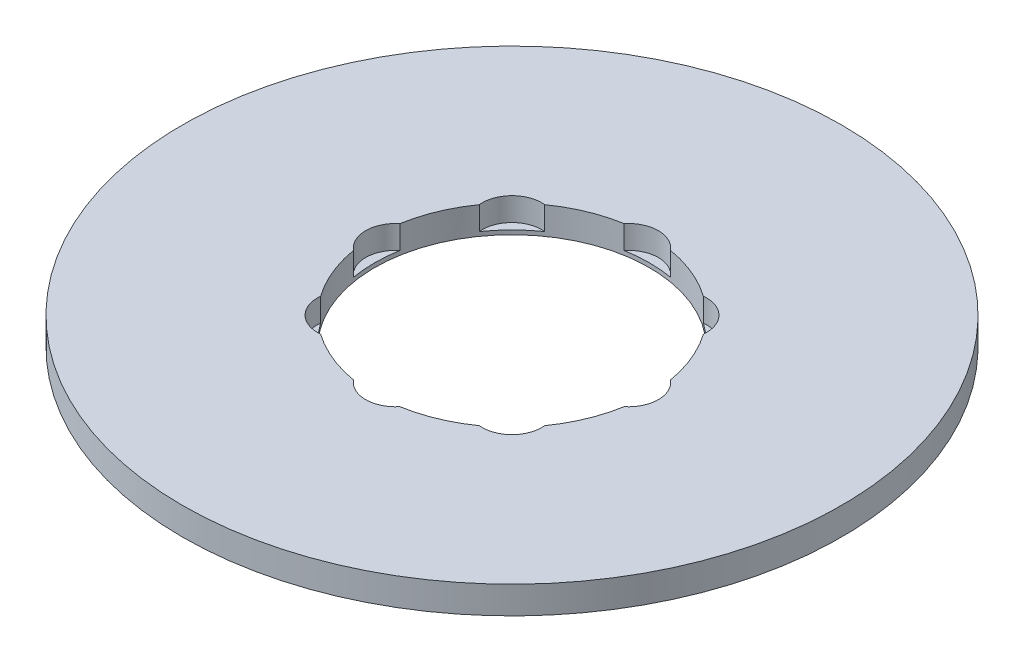
from build123d import *

# Parameters (mm, degrees)
SKETCH1_R           = 60
BOSS_EXTRUDE1_DEPTH = 5
SKETCH2_R           = 25
CUT_EXTRUDE1_DEPTH  = 86
SKETCH3_R           = 5.43317354
CUT_EXTRUDE2_DEPTH  = 4.237939286
CIRPATTERN1_COUNT   = 8


with BuildPart() as part:
    # Sketch1 → Boss-Extrude1 (new body)
    with BuildSketch(Plane(origin=(0, 0, 0), x_dir=(1, 0, 0), z_dir=(0, 1, 0))):
        Circle(SKETCH1_R)
    extrude(amount=BOSS_EXTRUDE1_DEPTH)

    # Sketch2 → Cut-Extrude1 (cut, through all)
    with BuildSketch(Plane(origin=(0, 0, 0), x_dir=(1, 0, 0), z_dir=(0, 1, 0))):
        Circle(SKETCH2_R)
    extrude(amount=CUT_EXTRUDE1_DEPTH, mode=Mode.SUBTRACT)

    # Sketch3 → Cut-Extrude2 (cut)
    with BuildSketch(Plane(origin=(0, 5, 0), x_dir=(1, 0, 0), z_dir=(0, 1, 0))):
        with Locations((-21.212737804, 0)):
            Circle(SKETCH3_R)
    cut_extrude2 = extrude(amount=-CUT_EXTRUDE2_DEPTH, mode=Mode.SUBTRACT)

    # CirPattern1: Cut-Extrude2 ×8 about axis
    cirpattern1_axis = Axis((0, 0, 0), (0, 1, 0))
    for i in range(1, CIRPATTERN1_COUNT):
        add(cut_extrude2.rotate(cirpattern1_axis, i * 360 / CIRPATTERN1_COUNT), mode=Mode.SUBTRACT)


solid = part.part
